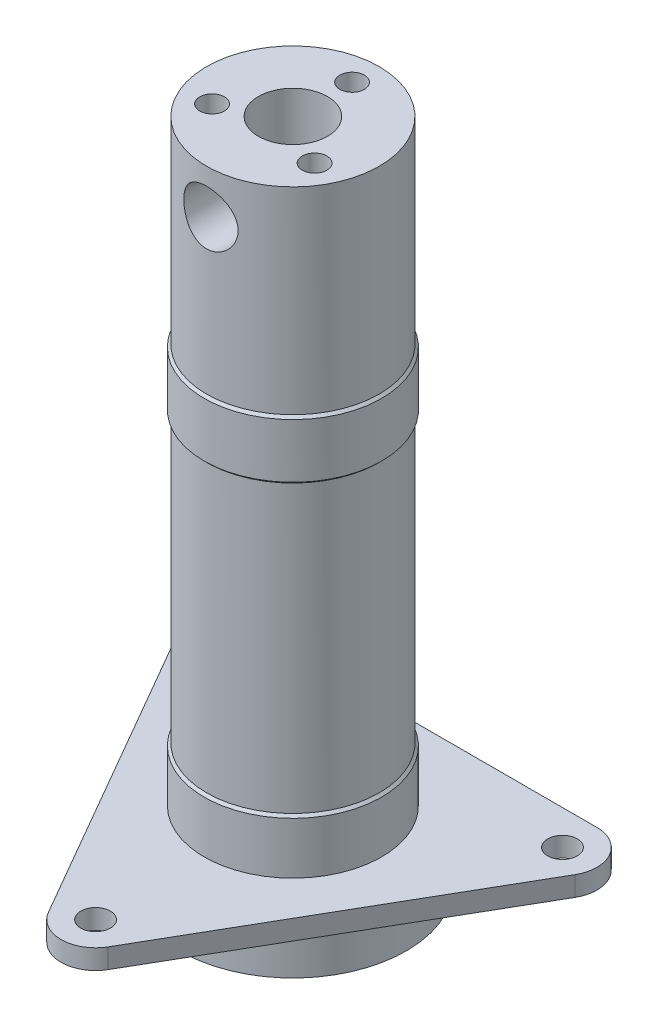
from build123d import *

# Parameters (mm, degrees)
CHAMFER_1_SIZE         = 0.5
CHAMFER_2_SIZE         = 1
SKETCH_9_OUTSIDE_W     = 67.946
SKETCH_9_OUTSIDE_H     = 67.946
SKETCH_9_OUTSIDE_R     = 1.5
CUT_EXTRUDE_2_DEPTH    = 71.786651284
HOLE_WIZARD_M3_1_D     = 2.5
HOLE_WIZARD_M3_1_DEPTH = 5
HOLE_WIZARD_M3_1_TIP   = 0.751075774
HOLE_WIZARD_M3_2_D     = 2.5
HOLE_WIZARD_M3_2_DEPTH = 6.5
HOLE_WIZARD_M3_2_TIP   = 0.751075774
SKETCH_11_R            = 2.75
CUT_EXTRUDE_4_DEPTH    = 70.942787738


with BuildPart() as part:
    # 草图2 → 旋转1 (revolve)
    with BuildSketch(Plane.XY, mode=Mode.PRIVATE) as revolve_1_sk:
        Polygon((9, 2), (9, 7), (8.75, 7), (8.75, 37), (9, 37), (9, 42), (8.75, 42), (8.75, 62.5), (3.5, 62.5), (3.5, 54), (6.5, 51), (6.5, -5), (11.5, -5), (11.5, 0), (23.5, 0), (23.5, 2), align=None)
    revolve(revolve_1_sk.sketch.rotate(Axis((0, 0, 0), (0, 1, 0)), 90), axis=Axis((0, 0, 0), (0, 1, 0)))

    # 倒角1
    # the kernel refuses this chamfer: 0.5 mm, written as the material it adds along each edge
    with BuildSketch(Plane(origin=(0, 42, 0), x_dir=(0, 0, -1), z_dir=(1, 0, 0))) as chamfer_1_piece_1_section:
        Polygon((8.75 + CHAMFER_1_SIZE, 0), (8.75, CHAMFER_1_SIZE), (8.75, 0), align=None)
    chamfer_1_piece_1 = revolve(axis=Axis((0, 42, 0), (0, 1, 0)), mode=Mode.PRIVATE)
    chamfer_1_piece_1 = chamfer_1_piece_1 & Plane(origin=(0, 42.369448451, 0), x_dir=(0, 0, -1), z_dir=(0, 1, 0)) * Cylinder(9, 38, mode=Mode.PRIVATE)
    add(chamfer_1_piece_1)
    with BuildSketch(Plane(origin=(0, 37, 0), x_dir=(0, 0, -1), z_dir=(1, 0, 0))) as chamfer_1_piece_2_section:
        Polygon((8.75, -CHAMFER_1_SIZE), (8.75 + CHAMFER_1_SIZE, 0), (8.75, 0), align=None)
    chamfer_1_piece_2 = revolve(axis=Axis((0, 37, 0), (0, 1, 0)), mode=Mode.PRIVATE)
    chamfer_1_piece_2 = chamfer_1_piece_2 & Plane(origin=(0, 36.630551549, 0), x_dir=(0, 0, -1), z_dir=(0, 1, 0)) * Cylinder(9, 38, mode=Mode.PRIVATE)
    add(chamfer_1_piece_2)
    with BuildSketch(Plane(origin=(0, 7, 0), x_dir=(0, 0, -1), z_dir=(1, 0, 0))) as chamfer_1_piece_3_section:
        Polygon((8.75 + CHAMFER_1_SIZE, 0), (8.75, CHAMFER_1_SIZE), (8.75, 0), align=None)
    chamfer_1_piece_3 = revolve(axis=Axis((0, 7, 0), (0, 1, 0)), mode=Mode.PRIVATE)
    chamfer_1_piece_3 = chamfer_1_piece_3 & Plane(origin=(0, 7.369448451, 0), x_dir=(0, 0, -1), z_dir=(0, 1, 0)) * Cylinder(9, 38, mode=Mode.PRIVATE)
    add(chamfer_1_piece_3)

    # 倒角2
    chamfer_2_edges = [part.edges().sort_by_distance(p)[0] for p in [
        (0, 0, 11.5),
    ]]
    chamfer(chamfer_2_edges, length=CHAMFER_2_SIZE)

    # 草图9 outside → 切除-拉伸2 (cut, through all)
    # profile 1 of 4: a face of its own
    with BuildSketch(Plane.XZ):
        Rectangle(SKETCH_9_OUTSIDE_W, SKETCH_9_OUTSIDE_H)
        with BuildLine():
            Line((-3.031088913, 21.75), (-20.351596989, -8.25))
            ThreePointArc((-20.351596989, -8.25), (-20.351596989, -11.75), (-17.320508076, -13.5))
            Line((-17.320508076, -13.5), (17.320508076, -13.5))
            ThreePointArc((17.320508076, -13.5), (20.351596989, -11.75), (20.351596989, -8.25))
            Line((20.351596989, -8.25), (3.031088913, 21.75))
            ThreePointArc((3.031088913, 21.75), (0, 23.5), (-3.031088913, 21.75))
        make_face(mode=Mode.SUBTRACT)
    # profile 2 of 4: a face of its own
    with BuildSketch(Plane.XZ):
        with Locations(Location((0, 20, 0), (0, 0, 270))):
            Circle(SKETCH_9_OUTSIDE_R)
    # profile 3 of 4: a face of its own
    with BuildSketch(Plane.XZ):
        with Locations(Location((17.320508076, -10, 0), (0, 0, 270))):
            Circle(SKETCH_9_OUTSIDE_R)
    # profile 4 of 4: a face of its own
    with BuildSketch(Plane.XZ):
        with Locations(Location((-17.320508076, -10, 0), (0, 0, 270))):
            Circle(SKETCH_9_OUTSIDE_R)
    extrude(amount=-CUT_EXTRUDE_2_DEPTH, mode=Mode.SUBTRACT)

    # M3 螺纹孔1
    with Locations(Plane.XZ.offset(5)):
        with Locations((0, -9), (7.794228634, 4.5), (-7.794228634, 4.5)):
            Hole(HOLE_WIZARD_M3_1_D / 2, depth=HOLE_WIZARD_M3_1_DEPTH)
            with Locations((0, 0, -(HOLE_WIZARD_M3_1_DEPTH + HOLE_WIZARD_M3_1_TIP / 2))):  # 118° drill point
                Cone(0, HOLE_WIZARD_M3_1_D / 2, HOLE_WIZARD_M3_1_TIP, mode=Mode.SUBTRACT)

    # M3 螺纹孔2
    with Locations(Plane(origin=(0, 62.5, 0), x_dir=(1, 0, 0), z_dir=(0, 1, 0))):
        with Locations((0, 6), (5.196152423, -3), (-5.196152423, -3)):
            Hole(HOLE_WIZARD_M3_2_D / 2, depth=HOLE_WIZARD_M3_2_DEPTH)
            with Locations((0, 0, -(HOLE_WIZARD_M3_2_DEPTH + HOLE_WIZARD_M3_2_TIP / 2))):  # 118° drill point
                Cone(0, HOLE_WIZARD_M3_2_D / 2, HOLE_WIZARD_M3_2_TIP, mode=Mode.SUBTRACT)

    # 草图11 → 切除-拉伸4 (cut, through all)
    with BuildSketch(Plane.XY):
        with Locations(Location((0, 58, 0), (0, 0, 180))):
            Circle(SKETCH_11_R)
    extrude(amount=CUT_EXTRUDE_4_DEPTH, mode=Mode.SUBTRACT)


solid = part.part
